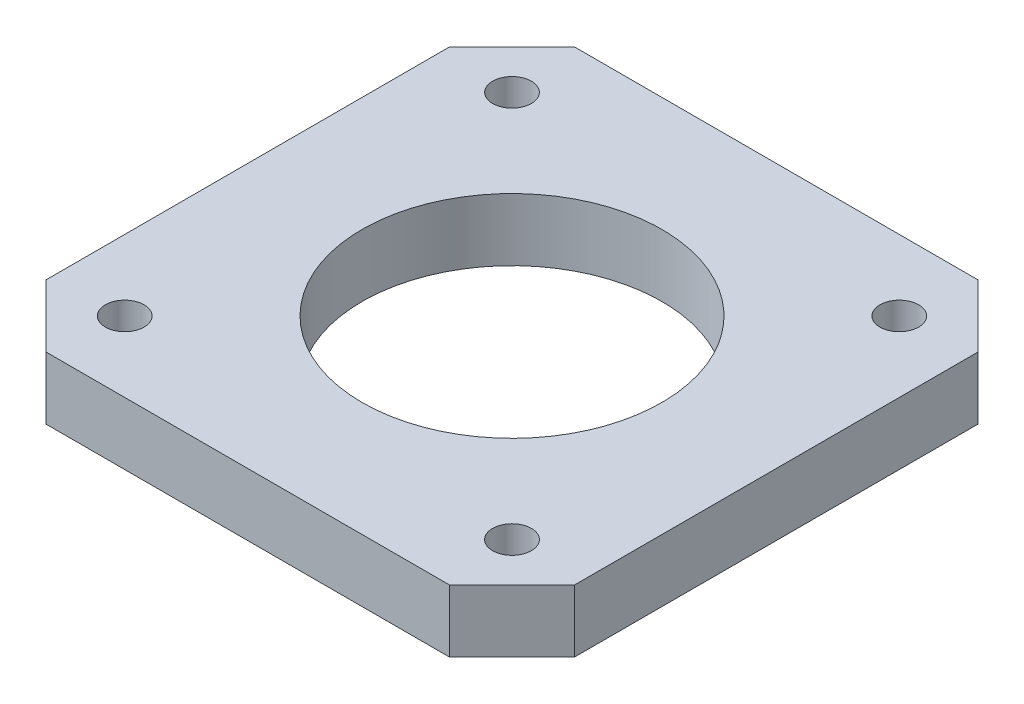
from build123d import *

# Parameters (mm, degrees)
SKETCH1_W           = 42.3
SKETCH1_H           = 42.3
SKETCH1_R           = 1.55
SKETCH1_R_2         = 12
BOSS_EXTRUDE1_DEPTH = 5
CHAMFER1_SIZE       = 5


with BuildPart() as part:
    # Sketch1 → Boss-Extrude1 (new body)
    with BuildSketch(Plane(origin=(0, 0, 0), x_dir=(1, 0, 0), z_dir=(0, 1, 0))):
        Rectangle(SKETCH1_W, SKETCH1_H)
        with Locations((-15.5, 15.5)):
            Circle(SKETCH1_R, mode=Mode.SUBTRACT)
        with Locations((15.5, 15.5)):
            Circle(SKETCH1_R, mode=Mode.SUBTRACT)
        with Locations((15.5, -15.5)):
            Circle(SKETCH1_R, mode=Mode.SUBTRACT)
        with Locations((-15.5, -15.5)):
            Circle(SKETCH1_R, mode=Mode.SUBTRACT)
        Circle(SKETCH1_R_2, mode=Mode.SUBTRACT)
    extrude(amount=BOSS_EXTRUDE1_DEPTH)

    # Chamfer1
    chamfer1_edges = [part.edges().sort_by_distance(p)[0] for p in [
        (21.15, 2.5, -21.15),
        (21.15, 2.5, 21.15),
        (-21.15, 2.5, -21.15),
        (-21.15, 2.5, 21.15),
    ]]
    chamfer(chamfer1_edges, length=CHAMFER1_SIZE)


solid = part.part
